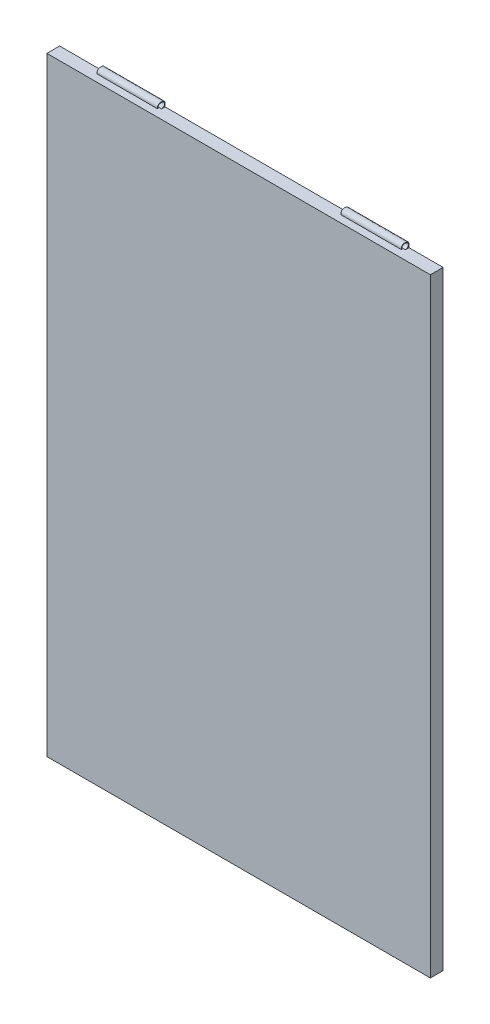
from build123d import *

# Parameters (mm, degrees)
BOSS_EXTRUDE2_DEPTH      = 5
BOSS_EXTRUDE2_DEPTH_BACK = 10
SKETCH1_W                = 120.517011816
SKETCH1_H                = 193.423301164
CUT_EXTRUDE1_DEPTH       = 117.520998071
CUT_EXTRUDE1_DEPTH_BACK  = 117.520998071
SKETCH2_W                = 10.720124134
SKETCH2_H                = 2
SKETCH2_W_2              = 57.651632978
SKETCH2_W_3              = 14.145254704
CUT_EXTRUDE2_START       = -95.651632978
CUT_EXTRUDE2_DEPTH       = 95.651632978
CUT_EXTRUDE4_DEPTH       = 156.859658163
CUT_EXTRUDE4_DEPTH_BACK  = 156.859658163
SKETCH5_W                = 11
SKETCH5_H                = 191.423301164
BOSS_EXTRUDE3_DEPTH      = 10
BOSS_EXTRUDE3_DRAFT      = 70
BOSS_EXTRUDE4_DEPTH      = 5
BOSS_EXTRUDE4_TAPER      = 17


# Read off the part's stored shape, not the designer's step: Cut-Extrude2
with BuildPart() as part:
    # Sketch1 → Boss-Extrude2 (new, two sides: drawn at the far end of the back side and taken through both)
    with BuildSketch(Plane.XY.offset(-BOSS_EXTRUDE2_DEPTH_BACK)):
        with Locations((0.408269184, 1.633076737)):
            Rectangle(SKETCH1_W, SKETCH1_H)
    extrude(amount=BOSS_EXTRUDE2_DEPTH + BOSS_EXTRUDE2_DEPTH_BACK)

    # Sketch2 → Cut-Extrude1 (cut, two sides: drawn at the far end of the back side and taken through both)
    with BuildSketch(Plane(origin=(0, 0, -10), x_dir=(-1, 0, 0), z_dir=(0, 0, -1)).offset(-CUT_EXTRUDE1_DEPTH_BACK)):
        with Locations((-55.306713025, 97.344727319)):
            Rectangle(SKETCH2_W, SKETCH2_H)
        with Locations((-2.120834469, 97.344727319)):
            Rectangle(SKETCH2_W_2, SKETCH2_H)
        with Locations((52.777609372, 97.344727319)):
            Rectangle(SKETCH2_W_3, SKETCH2_H)
    extrude(amount=CUT_EXTRUDE1_DEPTH + CUT_EXTRUDE1_DEPTH_BACK, mode=Mode.SUBTRACT)

    # Cut-Extrude2 outline → Cut-Extrude2 (cut)
    with BuildSketch(Plane(origin=(49.946650958, 0, 0), x_dir=(0, 0, -1), z_dir=(1, 0, 0)).offset(CUT_EXTRUDE2_START)):
        with BuildLine():
            Line((-5, 96.344727319), (8.880031812, 96.344727322))
            add(Edge.make_bspline(
                [(8.880031812, 96.344727322), (9.017757925, 96.389418818), (9.341148133, 96.502947325), (9.65511797, 96.721266154), (9.834207861, 97.091812499), (9.772304841, 97.682742311), (9.591846004, 97.952667933), (9.299739635, 98.085555426), (8.979382301, 98.13209035), (8.595809552, 98.122046866), (8.280683269, 98.057581679), (8.068335475, 97.930949515), (7.924267823, 97.772346881), (7.828035074, 97.54375556), (7.790578102, 97.292694013), (7.792508646, 97.124503178), (7.79875666, 97.046103501)],
                knots=[0.210157703, 0.210157703, 0.210157703, 0.210157703, 0.25, 0.3125, 0.375, 0.5, 0.625, 0.6875, 0.75, 0.8125, 0.875, 0.90625, 0.9375, 0.96875, 0.984375, 1, 1, 1, 1], degree=3))
            Line((7.79875666, 97.046103501), (7.599388771, 97.030214998))
            add(Edge.make_bspline(
                [(10, 97.255513039), (9.999998961, 97.447527895), (9.972419046, 97.629851143), (9.927722494, 97.794553197), (9.870710413, 97.937325839), (9.798783484, 98.058137149), (9.704435395, 98.159491912), (9.580897677, 98.243174202), (9.426924325, 98.307669655), (9.246866395, 98.348516931), (9.047009529, 98.36212633), (8.833423752, 98.351560976), (8.612813999, 98.330782958), (8.391619774, 98.318858897), (8.17208277, 98.31353746), (7.941741695, 98.247701653), (7.690138593, 98.003146143), (7.552784018, 97.615008356), (7.599388771, 97.030214998)],
                knots=[0.42378525, 0.42378525, 0.42378525, 0.42378525, 0.42378525, 0.42378525, 0.42378525, 0.42378525, 0.42378525, 0.42378525, 0.42378525, 0.42378525, 0.42378525, 0.42378525, 0.42378525, 0.42378525, 0.42378525, 0.42378525, 0.42378525, 1, 1, 1, 1, 1, 1, 1, 1, 1, 1, 1, 1, 1, 1, 1, 1, 1, 1, 1], degree=18))
            Line((10, 97.255513039), (10, 98.344727319))
            Line((10, 98.344727319), (-5, 98.344727319))
            Line((-5, 98.344727319), (-5, 96.344727319))
        make_face()
    extrude(amount=CUT_EXTRUDE2_DEPTH, mode=Mode.SUBTRACT)

    # Sketch5 → Cut-Extrude4 (cut, two sides: drawn at the far end of the back side and taken through both)
    with BuildSketch(Plane(origin=(60.666775092, 0, 0), x_dir=(0, 0, -1), z_dir=(1, 0, 0)).offset(-CUT_EXTRUDE4_DEPTH_BACK)):
        with Locations((0.5, 0.633076737)):
            Rectangle(SKETCH5_W, SKETCH5_H)
    extrude(amount=CUT_EXTRUDE4_DEPTH + CUT_EXTRUDE4_DEPTH_BACK, mode=Mode.SUBTRACT)


with BuildPart() as boss_extrude3_tool:
    # Sketch6 → Boss-Extrude3 (with draft: the straight prism first)
    with BuildSketch(Plane(origin=(0, 0, -10), x_dir=(-1, 0, 0), z_dir=(0, 0, -1))):
        Polygon((-49.946650958, 96.344727319), (-60.666775092, 96.344727319), (-60.666775092, -95.078573845), (59.850236724, -95.078573845), (59.850236724, 96.344727319), (45.70498202, 96.344727319), (26.70498202, 96.344727319), (-30.946650958, 96.344727319), align=None)
    extrude(amount=BOSS_EXTRUDE3_DEPTH)
    # Boss-Extrude3: the draft: its side faces are tilted about the plane it starts from
    boss_extrude3_sides = [boss_extrude3_tool.faces().sort_by_distance(p)[0] for p in [
        (0.408269184, 96.344727319, -15),
        (60.666775092, 0.633076737, -15),
        (0.408269184, -95.078573845, -15),
        (-59.850236724, 0.633076737, -15),
    ]]
    draft(boss_extrude3_sides, Plane(origin=(0, 0, -10), x_dir=(-1, 0, 0), z_dir=(0, 0, -1)), BOSS_EXTRUDE3_DRAFT)


with BuildPart() as part_1:
    add(part.part)

    # Boss-Extrude3: add boss_extrude3_tool
    add(boss_extrude3_tool.part)

    # Sketch7 → Boss-Extrude4 (add)
    with BuildSketch(Plane(origin=(0, 0, -20), x_dir=(-1, 0, 0), z_dir=(0, 0, -1))):
        with BuildLine():
            ThreePointArc((-11.292084394, -51.674806102), (-0.79402055, -59.989504928), (9.681667321, -51.646632242))
            ThreePointArc((9.681667321, -51.646632242), (8.230968391, -49.324207989), (5.908544137, -50.774906919))
            ThreePointArc((5.908544137, -50.774906919), (-0.79922246, -56.116994562), (-7.521316785, -50.792947135))
            ThreePointArc((-7.521316785, -50.792947135), (-9.847630073, -49.348492814), (-11.292084394, -51.674806102))
        make_face()
    extrude(amount=BOSS_EXTRUDE4_DEPTH, taper=BOSS_EXTRUDE4_TAPER)


solid = part_1.part
